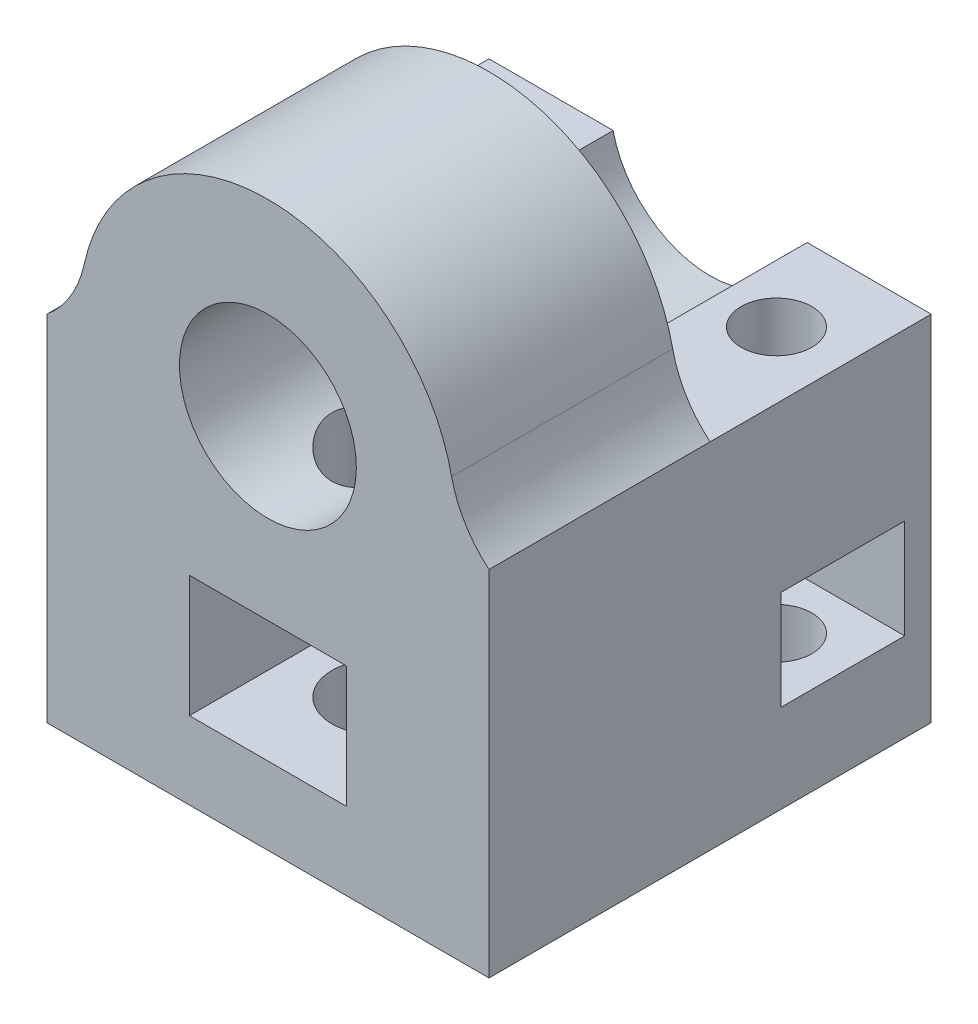
from build123d import *

# Parameters (mm, degrees)
SKETCH1_R                       = 4
BOSS_EXTRUDE1_DEPTH             = 5
BOSS_EXTRUDE2_DEPTH             = 10
BOSS_EXTRUDE2_DIRECTION_2_REACH = 23.477
CUT_EXTRUDE1_REACH              = 33.229
CUT_EXTRUDE1_END_RADIUS         = 4
SKETCH2_R                       = 2.1
CUT_EXTRUDE2_START              = -3.5
CUT_EXTRUDE2_DEPTH              = 5.5
FILLET1_R                       = 5
SKETCH5_R                       = 1.6
CUT_EXTRUDE3_DEPTH              = 32.228992939
CUT_EXTRUDE4_START              = -4
CUT_EXTRUDE4_DEPTH              = 4.5


with BuildPart() as part:
    # Sketch1 → Boss-Extrude1 (new, symmetric)
    with BuildSketch(Plane.XY):
        with BuildLine():
            Line((-8, -2.872281323), (-8, -17))
            Line((-8, -17), (8, -17))
            Line((8, -17), (8, -2.872281323))
            ThreePointArc((8, -2.872281323), (0, 8.5), (-8, -2.872281323))
        make_face()
        Circle(SKETCH1_R, mode=Mode.SUBTRACT)
    extrude(amount=BOSS_EXTRUDE1_DEPTH, both=True)

    # Sketch4 → Boss-Extrude2 (add)
    with BuildSketch(Plane(origin=(0, 0, -5), x_dir=(-1, 0, 0), z_dir=(0, 0, -1))):
        with BuildLine():
            Line((-10, -1), (-4.387482194, -1))
            ThreePointArc((-4.387482194, -1), (0, -4.5), (4.387482194, -1))
            Line((4.387482194, -1), (10, -1))
            Line((10, -1), (10, -17))
            Line((10, -17), (-10, -17))
            Line((-10, -17), (-10, -1))
        make_face()
    extrude(amount=BOSS_EXTRUDE2_DEPTH)

    # Boss-Extrude2 direction 2: up to this face of the body (flat: up to its plane)
    boss_extrude2_direction_2_end = Plane(part.part.faces().sort_by_distance((0, -5.649299223, 5))[0])
    # Sketch4 → Boss-Extrude2 direction 2 (add, up to the picked face)
    with BuildSketch(Plane(origin=(0, 0, -5), x_dir=(-1, 0, 0), z_dir=(0, 0, -1)), mode=Mode.PRIVATE) as boss_extrude2_direction_2_sk1:
        with BuildLine():
            Line((-10, -1), (-4.387482194, -1))
            ThreePointArc((-4.387482194, -1), (0, -4.5), (4.387482194, -1))
            Line((4.387482194, -1), (10, -1))
            Line((10, -1), (10, -17))
            Line((10, -17), (-10, -17))
            Line((-10, -17), (-10, -1))
        make_face()
    boss_extrude2_direction_2_tool1 = split(extrude(boss_extrude2_direction_2_sk1.sketch, amount=-BOSS_EXTRUDE2_DIRECTION_2_REACH, mode=Mode.PRIVATE), bisect_by=boss_extrude2_direction_2_end, keep=Keep.BOTH, mode=Mode.PRIVATE)
    add(boss_extrude2_direction_2_tool1.solids().sort_by(Axis((0, -9.503652, -5), (0, 0, 1)))[0])

    # Cut-Extrude1: up to this cylinder (the profile starts outside it)
    cut_extrude1_end = Plane(origin=(0, 0, 0), z_dir=(0, 0, -1)) * Cylinder(CUT_EXTRUDE1_END_RADIUS, 75.458, mode=Mode.PRIVATE)
    # Sketch2 → Cut-Extrude1 (cut, up to the surface)
    with BuildSketch(Plane.XZ.offset(17), mode=Mode.PRIVATE) as cut_extrude1_sk1:
        with Locations(Location((0, 0, 0), (0, 0, 270))):
            Circle(SKETCH2_R)
    cut_extrude1_tool1 = extrude(cut_extrude1_sk1.sketch, amount=-CUT_EXTRUDE1_REACH, mode=Mode.PRIVATE) - cut_extrude1_end
    add(cut_extrude1_tool1.solids().sort_by_distance((0, -17, 0))[0], mode=Mode.SUBTRACT)

    # Sketch3 → Cut-Extrude2 (cut)
    with BuildSketch(Plane.XZ.offset(17).offset(CUT_EXTRUDE2_START)):
        Polygon((-3.55, 2.049593456), (-3.55, 5), (3.55, 5), (3.55, 2.049593456), (3.55, -2.049593456), (0, -4.099186911), (-3.55, -2.049593456), align=None)
    extrude(amount=-CUT_EXTRUDE2_DEPTH, mode=Mode.SUBTRACT)

    # Fillet1
    # the kernel refuses this fillet: 5 mm, written as the material it adds along each edge
    with BuildSketch(Plane(origin=(-8.440971508, -1, -5), x_dir=(-1, 0, 0), z_dir=(0, 0, 1))) as fillet1_piece_1:
        with BuildLine():
            CenterArc((4.755970452, -3.844419605), FILLET1_R, 129.746228544, 38.09052624)
            Line((-0.131785829, -2.790930863), (-0.229540955, -2.769861088))
            ThreePointArc((-0.229540955, -2.769861088), (-0.050320463, -1.396200752), (-0.099305547, -0.011764706))
            Line((-0.099305547, -0.011764706), (0, 0.1))
            ThreePointArc((0, 0.1), (0.779514246, 0.1), (1.495089653, 0.076888392))
            Line((1.495089653, 0.076888392), (1.559028492, 0))
        make_face()
    extrude(amount=10)
    with BuildSketch(Plane(origin=(8.440971508, -1, -5), x_dir=(1, 0, 0), z_dir=(0, 0, 1))) as fillet1_piece_2:
        with BuildLine():
            CenterArc((4.755970452, 3.844419605), FILLET1_R, 192.163245216, 38.09052624)
            Line((-0.131785829, 2.790930863), (-0.229540955, 2.769861088))
            ThreePointArc((-0.229540955, 2.769861088), (-0.050320463, 1.396200752), (-0.099305547, 0.011764706))
            Line((-0.099305547, 0.011764706), (0, -0.1))
            ThreePointArc((0, -0.1), (0.779514246, -0.1), (1.495089653, -0.076888392))
            Line((1.495089653, -0.076888392), (1.559028492, 0))
        make_face()
    extrude(amount=10)

    # Sketch5 → Cut-Extrude3 (cut, through all)
    with BuildSketch(Plane.XZ.offset(17)):
        with Locations((7, -11)):
            Circle(SKETCH5_R)
        with Locations((-7, -11)):
            Circle(SKETCH5_R)
    extrude(amount=-CUT_EXTRUDE3_DEPTH, mode=Mode.SUBTRACT)

    # Sketch6 → Cut-Extrude4 (cut)
    with BuildSketch(Plane.XZ.offset(17).offset(CUT_EXTRUDE4_START)):
        Polygon((-8.616580754, -8.2), (-10, -8.2), (-10, -13.8), (-8.616580754, -13.8), (-5.383419246, -13.8), (-3.766838493, -11), (-5.383419246, -8.2), align=None)
        Polygon((8.616580754, -8.2), (5.383419246, -8.2), (3.766838493, -11), (5.383419246, -13.8), (8.616580754, -13.8), (10, -13.8), (10, -8.2), align=None)
    extrude(amount=-CUT_EXTRUDE4_DEPTH, mode=Mode.SUBTRACT)


solid = part.part
